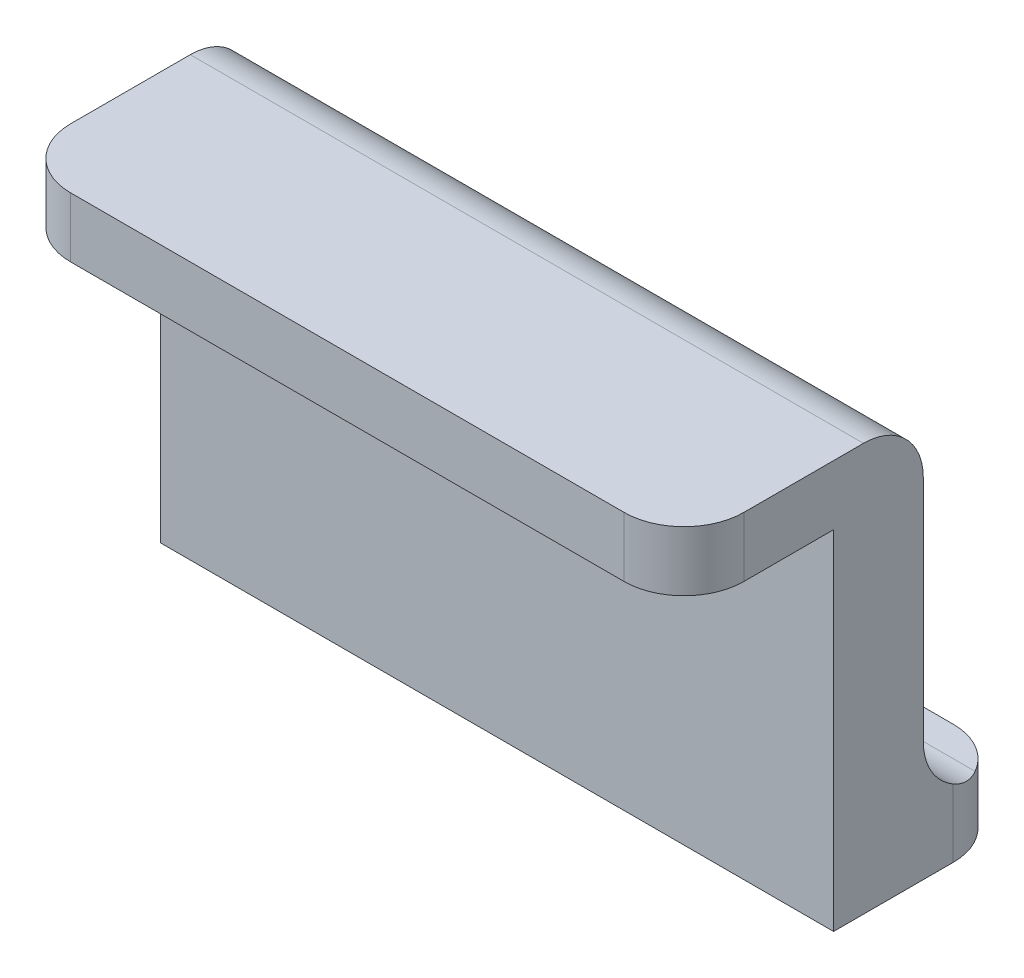
from build123d import *
from build123d.topology import SkipClean

# Parameters (mm, degrees)
BOSS_EXTRUDE1_DEPTH             = 2
BOSS_EXTRUDE2_START             = -13.63
BOSS_EXTRUDE2_DEPTH             = 13.63
BOSS_EXTRUDE3_DEPTH             = 2
SKETCH5_W                       = 22.5
SKETCH5_H                       = 6.1
CUT_EXTRUDE1_DEPTH              = 28.613527482
BOSS_EXTRUDE4_REACH             = 29.614
SKETCH6_W                       = 22.5
SKETCH6_H                       = 3
BOSS_EXTRUDE4_DIRECTION_2_REACH = 29.614
FILLET1_R                       = 2


with BuildPart() as part:
    # Sketch1 → Boss-Extrude1 (new body)
    with BuildSketch(Plane(origin=(0, 0, 0), x_dir=(1, 0, 0), z_dir=(0, 1, 0))):
        with BuildLine():
            Line((2, 0), (20.5, 0))
            ThreePointArc((20.5, 0), (21.914213562, 0.585786438), (22.5, 2))
            Line((22.5, 2), (22.5, 5))
            ThreePointArc((22.5, 5), (21.914213562, 6.414213562), (20.5, 7))
            Line((20.5, 7), (2, 7))
            ThreePointArc((2, 7), (0.585786438, 6.414213562), (0, 5))
            Line((0, 5), (0, 2))
            ThreePointArc((0, 2), (0.585786438, 0.585786438), (2, 0))
        make_face()
    extrude(amount=BOSS_EXTRUDE1_DEPTH)

    # Sketch2 → Boss-Extrude2 (add)
    with SkipClean():  # the faces are left unmerged after this step: merging them gives an invalid solid
        with BuildSketch(Plane(origin=(0, 2, 0), x_dir=(1, 0, 0), z_dir=(0, 1, 0)).offset(BOSS_EXTRUDE2_START)):
            with BuildLine():
                Line((22.5, 5), (22.5, 2))
                ThreePointArc((22.5, 2), (22.202938637, 0.951191152), (21.4, 0.21394289))
                Line((21.4, 0.21394289), (21.4, 3.1))
                ThreePointArc((21.4, 3.1), (20.521320344, 5.221320344), (18.4, 6.1))
                Line((18.4, 6.1), (4.1, 6.1))
                ThreePointArc((4.1, 6.1), (1.978679656, 5.221320344), (1.1, 3.1))
                Line((1.1, 3.1), (1.1, 0.21394289))
                ThreePointArc((1.1, 0.21394289), (0.297061363, 0.951191152), (0, 2))
                Line((0, 2), (0, 5))
                ThreePointArc((0, 5), (0.585786438, 6.414213562), (2, 7))
                Line((2, 7), (20.5, 7))
                ThreePointArc((20.5, 7), (21.914213562, 6.414213562), (22.5, 5))
            make_face()
        extrude(amount=BOSS_EXTRUDE2_DEPTH)
    add(part.part.scale(1), mode=Mode.REPLACE)  # the faces are merged on a copy

    # Sketch4 → Boss-Extrude3 (add)
    with BuildSketch(Plane.XZ.offset(11.63)):
        with BuildLine():
            Line((20.5, -7), (2, -7))
            ThreePointArc((2, -7), (0.585786438, -6.414213562), (0, -5))
            Line((0, -5), (0, -9))
            ThreePointArc((0, -9), (0.585786438, -10.414213562), (2, -11))
            Line((2, -11), (20.5, -11))
            ThreePointArc((20.5, -11), (21.914213562, -10.414213562), (22.5, -9))
            Line((22.5, -9), (22.5, -5))
            ThreePointArc((22.5, -5), (21.914213562, -6.414213562), (20.5, -7))
        make_face()
    extrude(amount=-BOSS_EXTRUDE3_DEPTH)

    # Sketch5 → Cut-Extrude1 (cut, through all)
    with BuildSketch(Plane.XZ):
        with Locations((11.25, -3.05)):
            Rectangle(SKETCH5_W, SKETCH5_H)
    extrude(amount=CUT_EXTRUDE1_DEPTH, mode=Mode.SUBTRACT)

    # Boss-Extrude4: up to this face of the body (flat: up to its plane)
    boss_extrude4_end = Plane(part.part.faces().sort_by_distance((11.25, 2, -3.5))[0])
    # Sketch6 → Boss-Extrude4 (add, up to the picked face)
    with BuildSketch(Plane(origin=(0, -9.63, 0), x_dir=(1, 0, 0), z_dir=(0, 1, 0)), mode=Mode.PRIVATE) as boss_extrude4_sk1:
        with Locations((11.25, 6.5)):
            Rectangle(SKETCH6_W, SKETCH6_H)
    boss_extrude4_tool1 = split(extrude(boss_extrude4_sk1.sketch, amount=BOSS_EXTRUDE4_REACH, mode=Mode.PRIVATE), bisect_by=boss_extrude4_end, keep=Keep.BOTH, mode=Mode.PRIVATE)
    add(boss_extrude4_tool1.solids().sort_by(Axis((11.25, -9.63, -6.5), (0, 1, 0)))[0])

    # Boss-Extrude4 direction 2: up to this face of the body (flat: up to its plane)
    boss_extrude4_direction_2_end = Plane(part.part.faces().sort_by_distance((11.25, -11.63, -8.518311689))[0])
    # Sketch6 → Boss-Extrude4 direction 2 (add, up to the picked face)
    with BuildSketch(Plane(origin=(0, -9.63, 0), x_dir=(1, 0, 0), z_dir=(0, 1, 0)), mode=Mode.PRIVATE) as boss_extrude4_direction_2_sk1:
        with Locations((11.25, 6.5)):
            Rectangle(SKETCH6_W, SKETCH6_H)
    boss_extrude4_direction_2_tool1 = split(extrude(boss_extrude4_direction_2_sk1.sketch, amount=-BOSS_EXTRUDE4_DIRECTION_2_REACH, mode=Mode.PRIVATE), bisect_by=boss_extrude4_direction_2_end, keep=Keep.BOTH, mode=Mode.PRIVATE)
    add(boss_extrude4_direction_2_tool1.solids().sort_by(Axis((11.25, -9.63, -6.5), (0, -1, 0)))[0])

    # Fillet1
    fillet1_edges = [part.edges().sort_by_distance(p)[0] for p in [
        (11.25, -9.63, -8),
        (11.25, 2, -8),
    ]]
    fillet(fillet1_edges, radius=FILLET1_R)


solid = part.part
